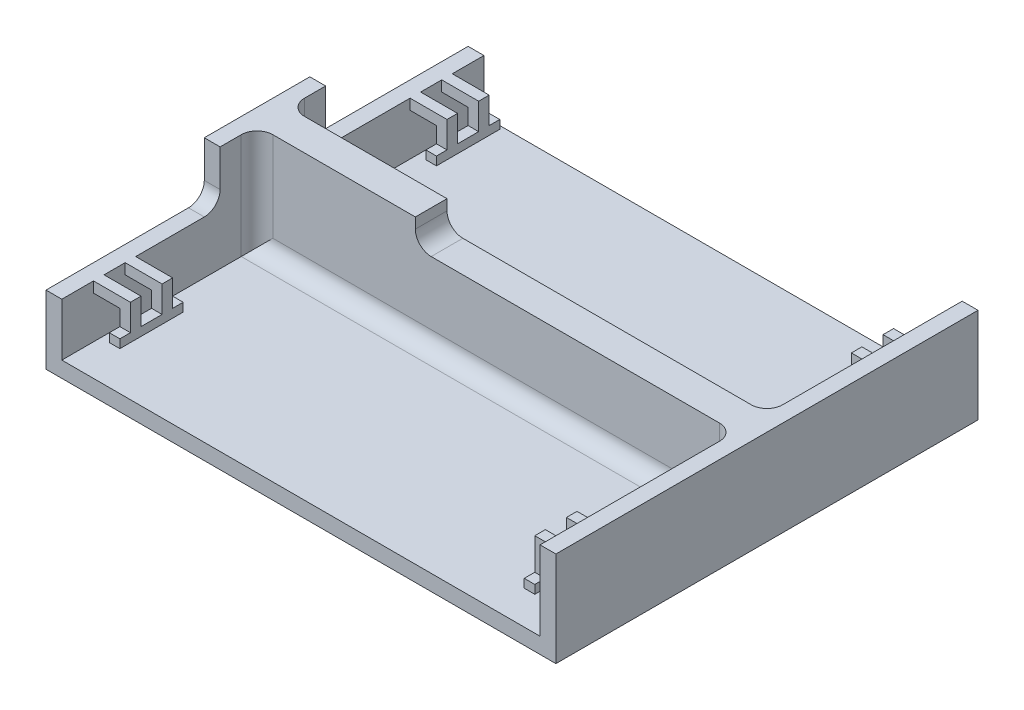
from build123d import *

# Parameters (mm, degrees)
ESTRUSIONE_ESTRUSIONE1_DEPTH = 40
SCHIZZO2_W                   = 30
SCHIZZO2_H                   = 10
TAGLIO_ESTRUSIONE2_DEPTH     = 3
RACCORDO1_R                  = 3
ESTRUSIONE_ESTRUSIONE2_DEPTH = 3
RACCORDO1_OF_SPECCHIA1_R     = 3
RACCORDO2_R                  = 3
SCHIZZO4_W                   = 2
SCHIZZO4_H                   = 2
ESTRUSIONE_ESTRUSIONE3_DEPTH = 7
SCHIZZO6_W                   = 2
SCHIZZO6_H                   = 2
ESTRUSIONE_ESTRUSIONE5_DEPTH = 3
SCHIZZO7_W                   = 2
SCHIZZO7_H                   = 12
ESTRUSIONE_ESTRUSIONE6_DEPTH = 1.62
SCHIZZO8_W                   = 2
SCHIZZO8_H                   = 2
ESTRUSIONE_ESTRUSIONE7_DEPTH = 7
SCHIZZO9_W                   = 2
SCHIZZO9_H                   = 2
ESTRUSIONE_ESTRUSIONE8_DEPTH = 4
SCHIZZO10_W                  = 2
SCHIZZO10_H                  = 12
ESTRUSIONE_ESTRUSIONE9_DEPTH = 1.62


with BuildPart() as part:
    # Schizzo1 → Estrusione-Estrusione1 (new body)
    with BuildSketch(Plane.XY):
        Polygon((25.288328624, 10.943510702), (25.288328624, 30.943510702), (22.288328624, 30.943510702), (22.288328624, 7.943510702), (118.928328624, 7.943510702), (118.928328624, 25.943510702), (115.928328624, 25.943510702), (115.928328624, 10.943510702), align=None)
    estrusione_estrusione1 = extrude(amount=ESTRUSIONE_ESTRUSIONE1_DEPTH)

    # Schizzo2 → Taglio-Estrusione2 (cut)
    with BuildSketch(Plane(origin=(25.288328624, 0, 0), x_dir=(0, 0, -1), z_dir=(1, 0, 0))):
        with Locations((-25, 25.943510702)):
            Rectangle(SCHIZZO2_W, SCHIZZO2_H)
    taglio_estrusione2 = extrude(amount=-TAGLIO_ESTRUSIONE2_DEPTH, mode=Mode.SUBTRACT)

    # Raccordo1
    raccordo1_edges = [part.edges().sort_by_distance(p)[0] for p in [
        (23.788328624, 20.943510702, 10),
    ]]
    fillet(raccordo1_edges, radius=RACCORDO1_R)

    # Schizzo3 → Estrusione-Estrusione2 (add)
    with BuildSketch(Plane(origin=(0, 0, 0), x_dir=(-1, 0, 0), z_dir=(0, 0, -1))):
        Polygon((-25.288328624, 30.943510702), (-55.288328624, 30.943510702), (-55.288328624, 25.943510702), (-115.928328624, 25.943510702), (-115.928328624, 10.943510702), (-25.288328624, 10.943510702), align=None)
    estrusione_estrusione2 = extrude(amount=-ESTRUSIONE_ESTRUSIONE2_DEPTH)

    # Specchia1: Estrusione-Estrusione1, Taglio-Estrusione2, Estrusione-Estrusione2 across plane
    add(estrusione_estrusione1.mirror(Plane.XY))
    add(taglio_estrusione2.mirror(Plane.XY), mode=Mode.SUBTRACT)
    add(estrusione_estrusione2.mirror(Plane.XY))

    # Raccordo1 of Specchia1
    raccordo1_of_specchia1_edges = [part.edges().sort_by_distance(p)[0] for p in [
        (23.788328624, 20.943510702, -10),
    ]]
    fillet(raccordo1_of_specchia1_edges, radius=RACCORDO1_OF_SPECCHIA1_R)

    # Raccordo2
    raccordo2_edges = [part.edges().sort_by_distance(p)[0] for p in [
        (70.608328624, 10.943510702, 3),
        (70.608328624, 10.943510702, -3),
        (115.928328624, 18.443510702, -3),
        (115.928328624, 18.443510702, 3),
        (55.288328624, 25.943510702, 0),
        (25.288328624, 20.943510702, -3),
        (25.288328624, 20.943510702, 3),
    ]]
    fillet(raccordo2_edges, radius=RACCORDO2_R)

    # Schizzo4 → Estrusione-Estrusione3 (add)
    with BuildSketch(Plane(origin=(25.288328624, 0, 0), x_dir=(0, 0, -1), z_dir=(1, 0, 0))):
        with Locations((-33, 19.943510702)):
            Rectangle(SCHIZZO4_W, SCHIZZO4_H)
        with Locations((-27, 19.943510702)):
            Rectangle(SCHIZZO4_W, SCHIZZO4_H)
    estrusione_estrusione3 = extrude(amount=ESTRUSIONE_ESTRUSIONE3_DEPTH)

    # Schizzo6 → Estrusione-Estrusione5 (add)
    with BuildSketch(Plane.XZ.offset(-18.943510702)):
        with Locations((31.288328624, 33)):
            Rectangle(SCHIZZO6_W, SCHIZZO6_H)
        with Locations((31.288328624, 27)):
            Rectangle(SCHIZZO6_W, SCHIZZO6_H)
    estrusione_estrusione5 = extrude(amount=ESTRUSIONE_ESTRUSIONE5_DEPTH)

    # Schizzo7 → Estrusione-Estrusione6 (add)
    with BuildSketch(Plane.XZ.offset(-15.943510702)):
        with Locations((31.288328624, 30)):
            Rectangle(SCHIZZO7_W, SCHIZZO7_H)
    estrusione_estrusione6 = extrude(amount=ESTRUSIONE_ESTRUSIONE6_DEPTH)

    # Schizzo8 → Estrusione-Estrusione7 (add)
    with BuildSketch(Plane.ZY.offset(-115.928328624)):
        with Locations((33, 19.943510702)):
            Rectangle(SCHIZZO8_W, SCHIZZO8_H)
        with Locations((27, 19.943510702)):
            Rectangle(SCHIZZO8_W, SCHIZZO8_H)
    estrusione_estrusione7 = extrude(amount=ESTRUSIONE_ESTRUSIONE7_DEPTH)

    # Schizzo9 → Estrusione-Estrusione8 (add)
    with BuildSketch(Plane.XZ.offset(-18.943510702)):
        with Locations((109.928328624, 33)):
            Rectangle(SCHIZZO9_W, SCHIZZO9_H)
        with Locations((109.928328624, 27)):
            Rectangle(SCHIZZO9_W, SCHIZZO9_H)
    estrusione_estrusione8 = extrude(amount=ESTRUSIONE_ESTRUSIONE8_DEPTH)

    # Schizzo10 → Estrusione-Estrusione9 (add)
    with BuildSketch(Plane.XZ.offset(-14.943510702)):
        with Locations((109.928328624, 30)):
            Rectangle(SCHIZZO10_W, SCHIZZO10_H)
    estrusione_estrusione9 = extrude(amount=ESTRUSIONE_ESTRUSIONE9_DEPTH)

    # Specchia2: Estrusione-Estrusione3, Estrusione-Estrusione5, Estrusione-Estrusione6, Estrusione-Estrusione7, Estrusione-Estrusione8, Estrusione-Estrusione9 across plane
    add(estrusione_estrusione3.mirror(Plane.XY))
    add(estrusione_estrusione5.mirror(Plane.XY))
    add(estrusione_estrusione6.mirror(Plane.XY))
    add(estrusione_estrusione7.mirror(Plane.XY))
    add(estrusione_estrusione8.mirror(Plane.XY))
    add(estrusione_estrusione9.mirror(Plane.XY))


solid = part.part
